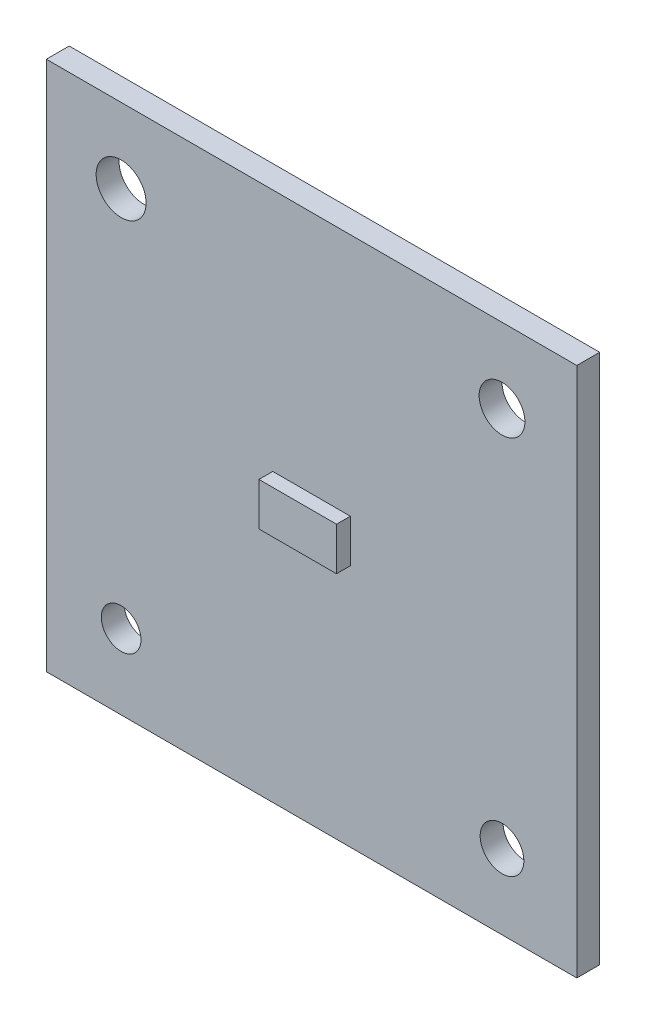
from build123d import *

# Parameters (mm, degrees)
SKIZZE1_W                       = 38.3
SKIZZE1_H                       = 38.3
SKIZZE1_R                       = 1.803576344
SKIZZE1_R_2                     = 1.651884651
SKIZZE1_R_3                     = 1.577721115
SKIZZE1_R_4                     = 1.431155303
AUFSATZ_LINEAR_AUSTRAGEN1_DEPTH = 1.65
SKIZZE2_W                       = 5.6
SKIZZE2_H                       = 3.1
AUFSATZ_LINEAR_AUSTRAGEN2_DEPTH = 1


with BuildPart() as part:
    # Skizze1 → Aufsatz-Linear austragen1 (new body)
    with BuildSketch(Plane.XY):
        Rectangle(SKIZZE1_W, SKIZZE1_H)
        with Locations((-13.75, 13.75)):
            Circle(SKIZZE1_R, mode=Mode.SUBTRACT)
        with Locations((13.75, 13.75)):
            Circle(SKIZZE1_R_2, mode=Mode.SUBTRACT)
        with Locations((13.75, -13.75)):
            Circle(SKIZZE1_R_3, mode=Mode.SUBTRACT)
        with Locations((-13.75, -13.75)):
            Circle(SKIZZE1_R_4, mode=Mode.SUBTRACT)
    extrude(amount=AUFSATZ_LINEAR_AUSTRAGEN1_DEPTH)

    # Skizze2 → Aufsatz-Linear austragen2 (add)
    with BuildSketch(Plane.XY.offset(1.65)):
        Rectangle(SKIZZE2_W, SKIZZE2_H)
    extrude(amount=AUFSATZ_LINEAR_AUSTRAGEN2_DEPTH)


solid = part.part
